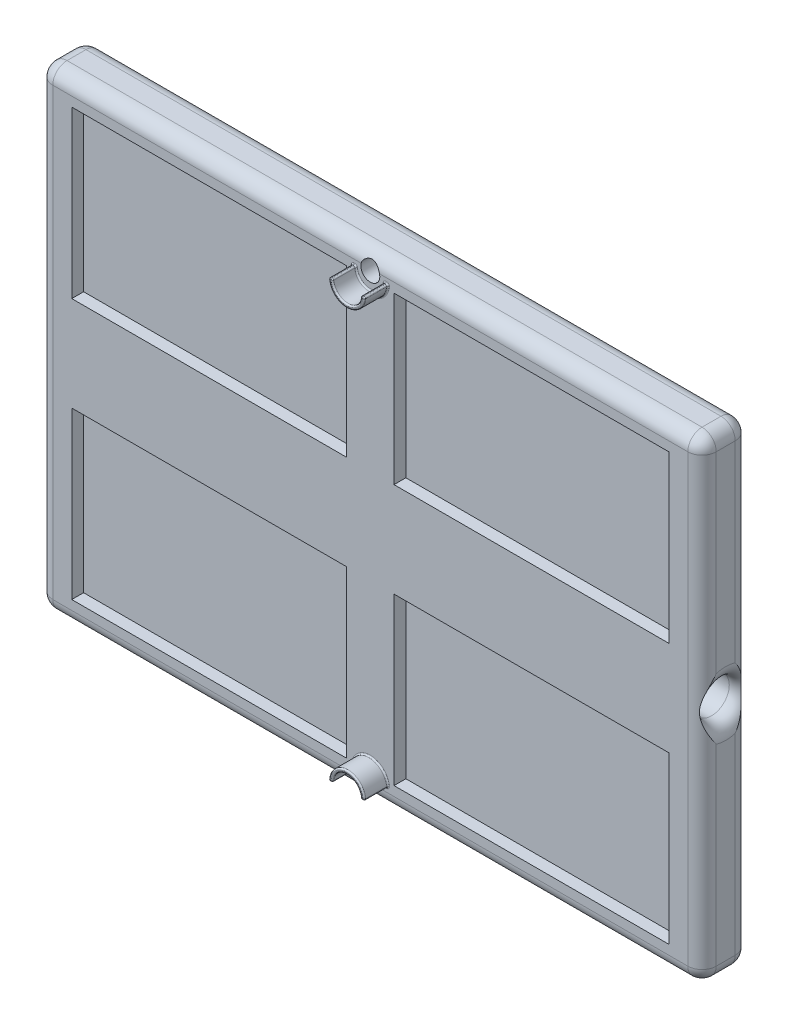
from build123d import *

# Parameters (mm, degrees)
SKETCH1_W           = 140
SKETCH1_H           = 100
BOSS_EXTRUDE1_DEPTH = 10
SKETCH2_W           = 58
SKETCH2_H           = 35
CUT_EXTRUDE1_DEPTH  = 2.5
SKETCH4_R           = 3.75
CUT_EXTRUDE2_DEPTH  = 140
BOSS_EXTRUDE3_DEPTH = 5
SKETCH6_R           = 2
CUT_EXTRUDE3_DEPTH  = 10
FILLET1_R           = 3
FILLET7_R           = 0.3


with BuildPart() as part:
    # Sketch1 → Boss-Extrude1 (new body)
    with BuildSketch(Plane.XY):
        Rectangle(SKETCH1_W, SKETCH1_H)
    extrude(amount=BOSS_EXTRUDE1_DEPTH)

    # Sketch2 → Cut-Extrude1 (cut)
    with BuildSketch(Plane.XY.offset(10)):
        with Locations((-34, 27.5)):
            Rectangle(SKETCH2_W, SKETCH2_H)
        with Locations((34, 27.5)):
            Rectangle(SKETCH2_W, SKETCH2_H)
        with Locations((34, -27.5)):
            Rectangle(SKETCH2_W, SKETCH2_H)
        with Locations((-34, -27.5)):
            Rectangle(SKETCH2_W, SKETCH2_H)
    extrude(amount=-CUT_EXTRUDE1_DEPTH, mode=Mode.SUBTRACT)

    # Sketch4 → Cut-Extrude2 (cut)
    with BuildSketch(Plane(origin=(70, 0, 0), x_dir=(0, 0, -1), z_dir=(1, 0, 0))):
        with Locations(Location((-5, 0, 0), (0, 0, 90))):
            Circle(SKETCH4_R)
    extrude(amount=-CUT_EXTRUDE2_DEPTH, mode=Mode.SUBTRACT)

    # Sketch5 → Boss-Extrude3 (add)
    with BuildSketch(Plane.XY.offset(10)):
        with BuildLine():
            ThreePointArc((-3.75, 46), (0, 42.25), (3.75, 46))
            Line((3.75, 46), (3, 46))
            ThreePointArc((3, 46), (0, 43), (-3, 46))
            Line((-3, 46), (-3.75, 46))
        make_face()
        with BuildLine():
            Line((3, -46), (3.75, -46))
            ThreePointArc((3.75, -46), (0, -42.25), (-3.75, -46))
            Line((-3.75, -46), (-3, -46))
            ThreePointArc((-3, -46), (0, -43), (3, -46))
        make_face()
    extrude(amount=BOSS_EXTRUDE3_DEPTH)

    # Sketch6 → Cut-Extrude3 (cut)
    with BuildSketch(Plane.XY.offset(10)):
        with Locations((0, -46.5)):
            Circle(SKETCH6_R)
        with Locations(Location((0, 46.5, 0), (0, 0, 180))):
            Circle(SKETCH6_R)
    extrude(amount=-CUT_EXTRUDE3_DEPTH, mode=Mode.SUBTRACT)

    # Fillet1
    # the kernel refuses this fillet: 3 mm, written as the material it takes off along each edge
    with BuildSketch(Plane(origin=(-67, -47, 7), x_dir=(0, 0, 1), z_dir=(-1, 0, 0))) as fillet1_piece_1_section:
        Polygon((0, 0), (FILLET1_R, 0), (FILLET1_R, -FILLET1_R), (0, -FILLET1_R), align=None)
    fillet1_piece_1 = extrude(amount=FILLET1_R, mode=Mode.PRIVATE)
    fillet1_piece_1 = fillet1_piece_1 - Plane(origin=(-67, -47, 7), x_dir=(0, 0.7071067811865475, -0.7071067811865475), z_dir=(-1, 0, 0)) * Sphere(FILLET1_R, mode=Mode.PRIVATE)
    add(fillet1_piece_1, mode=Mode.SUBTRACT)
    with BuildSketch(Plane(origin=(-67, 47, 7), x_dir=(-1, 0, 0), z_dir=(0, 1, 0))) as fillet1_piece_2_section:
        Polygon((0, 0), (FILLET1_R, 0), (FILLET1_R, FILLET1_R), (0, FILLET1_R), align=None)
    fillet1_piece_2 = extrude(amount=FILLET1_R, mode=Mode.PRIVATE)
    fillet1_piece_2 = fillet1_piece_2 - Plane(origin=(-67, 47, 7), x_dir=(0.7071067811865475, 0, -0.7071067811865475), z_dir=(0, 1, 0)) * Sphere(FILLET1_R, mode=Mode.PRIVATE)
    add(fillet1_piece_2, mode=Mode.SUBTRACT)
    with BuildSketch(Plane(origin=(67, -47, 7), x_dir=(0, 0, 1), z_dir=(1, 0, 0))) as fillet1_piece_3_section:
        Polygon((0, 0), (FILLET1_R, 0), (FILLET1_R, FILLET1_R), (0, FILLET1_R), align=None)
    fillet1_piece_3 = extrude(amount=FILLET1_R, mode=Mode.PRIVATE)
    fillet1_piece_3 = fillet1_piece_3 - Plane(origin=(67, -47, 7), x_dir=(0, 0.7071067811865475, -0.7071067811865475), z_dir=(1, 0, 0)) * Sphere(FILLET1_R, mode=Mode.PRIVATE)
    add(fillet1_piece_3, mode=Mode.SUBTRACT)
    with BuildSketch(Plane(origin=(67, 47, 7), x_dir=(1, 0, 0), z_dir=(0, 1, 0))) as fillet1_piece_4_section:
        Polygon((0, 0), (FILLET1_R, 0), (FILLET1_R, -FILLET1_R), (0, -FILLET1_R), align=None)
    fillet1_piece_4 = extrude(amount=FILLET1_R, mode=Mode.PRIVATE)
    fillet1_piece_4 = fillet1_piece_4 - Plane(origin=(67, 47, 7), x_dir=(-0.7071067811865475, 0, -0.7071067811865475), z_dir=(0, 1, 0)) * Sphere(FILLET1_R, mode=Mode.PRIVATE)
    add(fillet1_piece_4, mode=Mode.SUBTRACT)
    with BuildSketch(Plane(origin=(67, -47, 3), x_dir=(0, 0, -1), z_dir=(1, 0, 0))) as fillet1_piece_5_section:
        Polygon((0, 0), (FILLET1_R, 0), (FILLET1_R, -FILLET1_R), (0, -FILLET1_R), align=None)
    fillet1_piece_5 = extrude(amount=FILLET1_R, mode=Mode.PRIVATE)
    fillet1_piece_5 = fillet1_piece_5 - Plane(origin=(67, -47, 3), x_dir=(0, 0.7071067811865475, 0.7071067811865475), z_dir=(1, 0, 0)) * Sphere(FILLET1_R, mode=Mode.PRIVATE)
    add(fillet1_piece_5, mode=Mode.SUBTRACT)
    with BuildSketch(Plane(origin=(-67, -47, 3), x_dir=(0, 0, -1), z_dir=(-1, 0, 0))) as fillet1_piece_6_section:
        Polygon((0, 0), (FILLET1_R, 0), (FILLET1_R, FILLET1_R), (0, FILLET1_R), align=None)
    fillet1_piece_6 = extrude(amount=FILLET1_R, mode=Mode.PRIVATE)
    fillet1_piece_6 = fillet1_piece_6 - Plane(origin=(-67, -47, 3), x_dir=(0, 0.7071067811865475, 0.7071067811865475), z_dir=(-1, 0, 0)) * Sphere(FILLET1_R, mode=Mode.PRIVATE)
    add(fillet1_piece_6, mode=Mode.SUBTRACT)
    with BuildSketch(Plane(origin=(-67, 47, 3), x_dir=(-1, 0, 0), z_dir=(0, 1, 0))) as fillet1_piece_7_section:
        Polygon((0, 0), (FILLET1_R, 0), (FILLET1_R, -FILLET1_R), (0, -FILLET1_R), align=None)
    fillet1_piece_7 = extrude(amount=FILLET1_R, mode=Mode.PRIVATE)
    fillet1_piece_7 = fillet1_piece_7 - Plane(origin=(-67, 47, 3), x_dir=(0.7071067811865475, 0, 0.7071067811865475), z_dir=(0, 1, 0)) * Sphere(FILLET1_R, mode=Mode.PRIVATE)
    add(fillet1_piece_7, mode=Mode.SUBTRACT)
    with BuildSketch(Plane(origin=(67, 47, 3), x_dir=(1, 0, 0), z_dir=(0, 1, 0))) as fillet1_piece_8_section:
        Polygon((0, 0), (FILLET1_R, 0), (FILLET1_R, FILLET1_R), (0, FILLET1_R), align=None)
    fillet1_piece_8 = extrude(amount=FILLET1_R, mode=Mode.PRIVATE)
    fillet1_piece_8 = fillet1_piece_8 - Plane(origin=(67, 47, 3), x_dir=(-0.7071067811865475, 0, 0.7071067811865475), z_dir=(0, 1, 0)) * Sphere(FILLET1_R, mode=Mode.PRIVATE)
    add(fillet1_piece_8, mode=Mode.SUBTRACT)
    with BuildSketch(Plane(origin=(-70, -47, 10), x_dir=(0, 0, -1), z_dir=(0, 1, 0)), Plane(origin=(70, 47, 10), x_dir=(0, 0, -1), z_dir=(0, -1, 0))) as fillet1_piece_9:
        with BuildLine():
            CenterArc((FILLET1_R, -FILLET1_R), FILLET1_R, 90, 90)
            Line((0, -FILLET1_R), (0, 0))
            Line((0, 0), (FILLET1_R, 0))
        make_face()
    extrude(amount=94, mode=Mode.SUBTRACT)
    with BuildSketch(Plane(origin=(67, -50, 10), x_dir=(0, 1, 0), z_dir=(-1, 0, 0)), Plane(origin=(-67, 50, 0), x_dir=(0, 0, 1), z_dir=(1, 0, 0))) as fillet1_piece_10:
        with BuildLine():
            CenterArc((FILLET1_R, FILLET1_R), FILLET1_R, 180, 90)
            Line((0, FILLET1_R), (0, 0))
            Line((0, 0), (FILLET1_R, 0))
        make_face()
    extrude(amount=134, mode=Mode.SUBTRACT)
    with BuildSketch(Plane(origin=(67, -50, 0), x_dir=(0, 1, 0), z_dir=(-1, 0, 0)), Plane(origin=(-67, 50, 10), x_dir=(0, 0, -1), z_dir=(1, 0, 0))) as fillet1_piece_11:
        with BuildLine():
            CenterArc((FILLET1_R, -FILLET1_R), FILLET1_R, 90, 90)
            Line((0, -FILLET1_R), (0, 0))
            Line((0, 0), (FILLET1_R, 0))
        make_face()
    extrude(amount=134, mode=Mode.SUBTRACT)
    with BuildSketch(Plane(origin=(-70, -47, 0), x_dir=(0, 0, 1), z_dir=(0, 1, 0)), Plane(origin=(70, 47, 0), x_dir=(0, 0, 1), z_dir=(0, -1, 0))) as fillet1_piece_12:
        with BuildLine():
            CenterArc((FILLET1_R, FILLET1_R), FILLET1_R, 180, 90)
            Line((0, FILLET1_R), (0, 0))
            Line((0, 0), (FILLET1_R, 0))
        make_face()
    extrude(amount=94, mode=Mode.SUBTRACT)
    with BuildSketch(Plane(origin=(-70, 0, 5), x_dir=(0, 1, 0), z_dir=(0, 0, -1))) as fillet1_piece_13:
        with BuildLine():
            CenterArc((3.75 + FILLET1_R, FILLET1_R), FILLET1_R, 180, 90)
            Line((3.75, FILLET1_R), (3.75, 0))
            Line((3.75, 0), (3.75 + FILLET1_R, 0))
        make_face()
    revolve(axis=Axis((-70, 0, 5), (1, 0, 0)), mode=Mode.SUBTRACT)
    with BuildSketch(Plane(origin=(70, 0, 5), x_dir=(0, 1, 0), z_dir=(0, 0, -1))) as fillet1_piece_14:
        with BuildLine():
            CenterArc((3.75 + FILLET1_R, -FILLET1_R), FILLET1_R, 90, 90)
            Line((3.75, -FILLET1_R), (3.75, 0))
            Line((3.75, 0), (3.75 + FILLET1_R, 0))
        make_face()
    revolve(axis=Axis((70, 0, 5), (1, 0, 0)), mode=Mode.SUBTRACT)
    with BuildSketch(Plane(origin=(70, -50, 3), x_dir=(0, 1, 0), z_dir=(0, 0, 1)), Plane(origin=(70, 50, 3), x_dir=(-1, 0, 0), z_dir=(0, 0, 1))) as fillet1_piece_15:
        with BuildLine():
            CenterArc((FILLET1_R, FILLET1_R), FILLET1_R, 180, 90)
            Line((0, FILLET1_R), (0, 0))
            Line((0, 0), (FILLET1_R, 0))
        make_face()
    extrude(amount=4, mode=Mode.SUBTRACT)
    with BuildSketch(Plane(origin=(-70, -50, 3), x_dir=(0, 1, 0), z_dir=(0, 0, 1)), Plane(origin=(-70, 50, 3), x_dir=(1, 0, 0), z_dir=(0, 0, 1))) as fillet1_piece_16:
        with BuildLine():
            CenterArc((FILLET1_R, -FILLET1_R), FILLET1_R, 90, 90)
            Line((0, -FILLET1_R), (0, 0))
            Line((0, 0), (FILLET1_R, 0))
        make_face()
    extrude(amount=4, mode=Mode.SUBTRACT)

    # Fillet7
    fillet7_edges = [part.edges().sort_by_distance(p)[0] for p in [
        (0, 43, 15),
        (3, 46, 12.5),
        (-3.375, 46, 10),
        (-3, 46, 12.5),
        (0, 42.25, 10),
        (-3.75, 46, 12.5),
        (3.375, 46, 10),
        (3.75, 46, 12.5),
        (-3.375, 46, 15),
        (0, 42.25, 15),
        (3.375, 46, 15),
        (0, 43, 10),
        (0, -42.25, 15),
        (3.75, -46, 12.5),
        (-3.375, -46, 15),
        (-3.75, -46, 12.5),
        (0, -43, 10),
        (-3, -46, 12.5),
        (3.375, -46, 15),
        (3, -46, 12.5),
        (0, -43, 15),
        (0, -42.25, 10),
        (3.375, -46, 10),
        (-3.375, -46, 10),
    ]]
    fillet(fillet7_edges, radius=FILLET7_R)


solid = part.part
